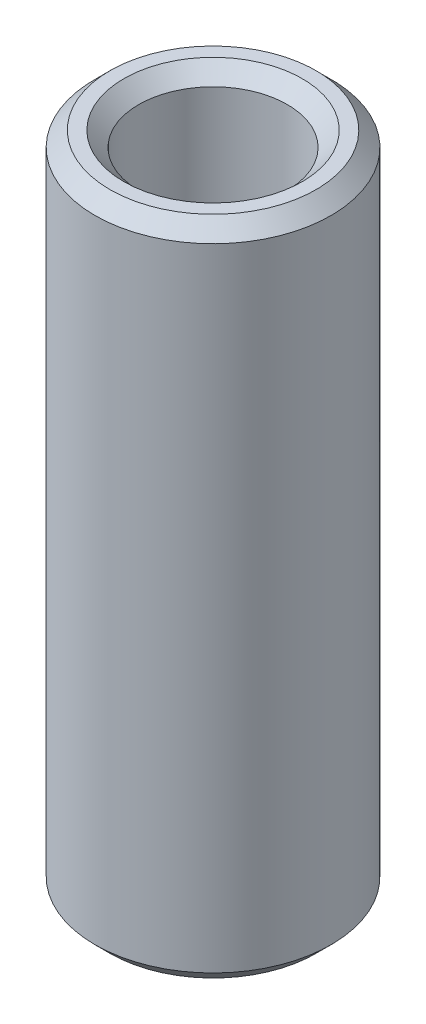
from build123d import *

# Parameters (mm, degrees)
SKETCH1_R           = 30
BOSS_EXTRUDE1_DEPTH = 168.139825975
SKETCH2_R           = 18.888638512
CUT_EXTRUDE1_DEPTH  = 174.409922089
CHAMFER1_SIZE       = 3.798683351


with BuildPart() as part:
    # Sketch1 → Boss-Extrude1 (new body)
    with BuildSketch(Plane(origin=(0, 0, 0), x_dir=(1, 0, 0), z_dir=(0, 1, 0))):
        Circle(SKETCH1_R)
    extrude(amount=BOSS_EXTRUDE1_DEPTH)

    # Sketch2 → Cut-Extrude1 (cut, through all)
    with BuildSketch(Plane(origin=(0, 0, 0), x_dir=(1, 0, 0), z_dir=(0, 1, 0))):
        Circle(SKETCH2_R)
    extrude(amount=CUT_EXTRUDE1_DEPTH, mode=Mode.SUBTRACT)

    # Chamfer1
    chamfer1_edges = [part.edges().sort_by_distance(p)[0] for p in [
        (-18.888638512, 168.139825975, 0),
        (-18.888638512, 0, 0),
        (-30, 0, 0),
        (-30, 168.139825975, 0),
    ]]
    chamfer(chamfer1_edges, length=CHAMFER1_SIZE)


solid = part.part
